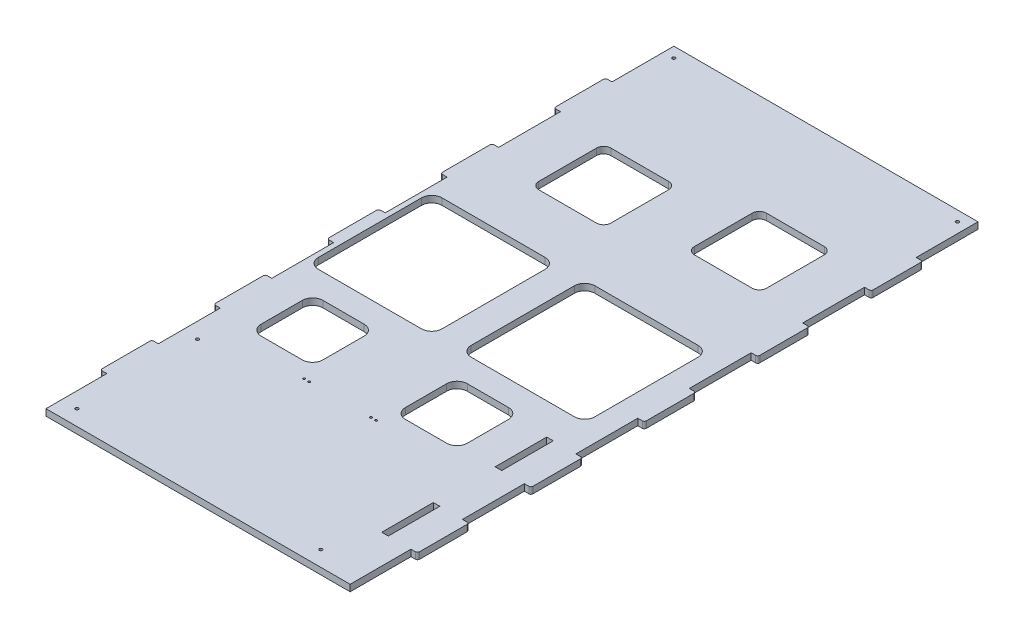
from build123d import *

# Parameters (mm, degrees)
BOSS_EXTRUDE1_DEPTH = 6.35
FILLET1_R           = 2
SKETCH2_R           = 1.5
SKETCH2_R_2         = 1.025
SKETCH2_W           = 6.35
SKETCH2_H           = 50
SKETCH2_W_2         = 120
SKETCH2_H_2         = 120
CUT_EXTRUDE1_DEPTH  = 6.35
FILLET2_R           = 10


with BuildPart() as part:
    # Sketch1 → Boss-Extrude1 (new body)
    with BuildSketch(Plane(origin=(0, 0, 0), x_dir=(1, 0, 0), z_dir=(0, 1, 0))):
        Polygon((0, 0), (295, 0), (295, 59), (301.35, 59), (301.35, 109), (295, 109), (295, 169), (301.35, 169), (301.35, 219), (295, 219), (295, 279), (301.35, 279), (301.35, 329), (295, 329), (295, 389), (301.35, 389), (301.35, 439), (295, 439), (295, 499), (301.35, 499), (301.35, 549), (295, 549), (295, 609), (0, 609), (0, 549), (-6.35, 549), (-6.35, 499), (0, 499), (0, 439), (-6.35, 439), (-6.35, 389), (0, 389), (0, 329), (-6.35, 329), (-6.35, 279), (0, 279), (0, 219), (-6.35, 219), (-6.35, 169), (0, 169), (0, 109), (-6.35, 109), (-6.35, 59), (0, 59), align=None)
    extrude(amount=BOSS_EXTRUDE1_DEPTH)

    # Fillet1
    fillet1_edges = [part.edges().sort_by_distance(p)[0] for p in [
        (301.35, 3.175, -549),
        (301.35, 3.175, -499),
        (301.35, 3.175, -439),
        (301.35, 3.175, -389),
        (301.35, 3.175, -329),
        (301.35, 3.175, -279),
        (301.35, 3.175, -219),
        (301.35, 3.175, -169),
        (301.35, 3.175, -109),
        (301.35, 3.175, -59),
        (-6.35, 3.175, -59),
        (-6.35, 3.175, -109),
        (-6.35, 3.175, -169),
        (-6.35, 3.175, -219),
        (-6.35, 3.175, -279),
        (-6.35, 3.175, -329),
        (-6.35, 3.175, -389),
        (-6.35, 3.175, -439),
        (-6.35, 3.175, -499),
        (-6.35, 3.175, -549),
    ]]
    fillet(fillet1_edges, radius=FILLET1_R)

    # Sketch2 → Cut-Extrude1 (cut)
    with BuildSketch(Plane(origin=(0, 6.35, 0), x_dir=(1, 0, 0), z_dir=(0, 1, 0))):
        with Locations((15, 15)):
            Circle(SKETCH2_R)
        with Locations((251.65, 15)):
            Circle(SKETCH2_R)
        with Locations((15, 131.925897501)):
            Circle(SKETCH2_R)
        with Locations((10, 599)):
            Circle(SKETCH2_R)
        with Locations((285, 599)):
            Circle(SKETCH2_R)
        with Locations((100, 150.297977664)):
            Circle(SKETCH2_R_2)
        with Locations((105, 150.297977664)):
            Circle(SKETCH2_R_2)
        with Locations((165, 150.297977664)):
            Circle(SKETCH2_R_2)
        with Locations((170, 150.297977664)):
            Circle(SKETCH2_R_2)
        with Locations((269.825, 194)):
            Rectangle(SKETCH2_W, SKETCH2_H)
        with Locations((269.825, 84)):
            Rectangle(SKETCH2_W, SKETCH2_H)
        with BuildLine():
            Line((55.042435698, 492.876808594), (111.042435698, 492.876808594))
            ThreePointArc((111.042435698, 492.876808594), (115.992183166, 490.826556062), (118.042435698, 485.876808594))
            Line((118.042435698, 485.876808594), (118.042435698, 429.876808594))
            ThreePointArc((118.042435698, 429.876808594), (115.992183166, 424.927061126), (111.042435698, 422.876808594))
            Line((111.042435698, 422.876808594), (55.042435698, 422.876808594))
            ThreePointArc((55.042435698, 422.876808594), (50.09268823, 424.927061126), (48.042435698, 429.876808594))
            Line((48.042435698, 429.876808594), (48.042435698, 485.876808594))
            ThreePointArc((48.042435698, 485.876808594), (50.09268823, 490.826556062), (55.042435698, 492.876808594))
        make_face()
        with BuildLine():
            Line((185.233522799, 513.658142081), (241.233522799, 513.658142081))
            ThreePointArc((241.233522799, 513.658142081), (246.183270267, 511.607889549), (248.233522799, 506.658142081))
            Line((248.233522799, 506.658142081), (248.233522799, 450.658142081))
            ThreePointArc((248.233522799, 450.658142081), (246.183270267, 445.708394612), (241.233522799, 443.658142081))
            Line((241.233522799, 443.658142081), (185.233522799, 443.658142081))
            ThreePointArc((185.233522799, 443.658142081), (180.283775331, 445.708394612), (178.233522799, 450.658142081))
            Line((178.233522799, 450.658142081), (178.233522799, 506.658142081))
            ThreePointArc((178.233522799, 506.658142081), (180.283775331, 511.607889549), (185.233522799, 513.658142081))
        make_face()
        with BuildLine():
            Line((43.325, 225.297977664), (83.325, 225.297977664))
            ThreePointArc((83.325, 225.297977664), (90.396067812, 222.369045476), (93.325, 215.297977664))
            Line((93.325, 215.297977664), (93.325, 175.297977664))
            ThreePointArc((93.325, 175.297977664), (90.396067812, 168.226909853), (83.325, 165.297977664))
            Line((83.325, 165.297977664), (43.325, 165.297977664))
            ThreePointArc((43.325, 165.297977664), (36.253932188, 168.226909853), (33.325, 175.297977664))
            Line((33.325, 175.297977664), (33.325, 215.297977664))
            ThreePointArc((33.325, 215.297977664), (36.253932188, 222.369045476), (43.325, 225.297977664))
        make_face()
        with Locations((65, 309.153604097)):
            Rectangle(SKETCH2_W_2, SKETCH2_H_2)
        with Locations((213, 309.452802196)):
            Rectangle(SKETCH2_W_2, SKETCH2_H_2)
        with BuildLine():
            Line((173.325, 215.297977664), (173.325, 175.297977664))
            ThreePointArc((173.325, 175.297977664), (176.253932188, 168.226909853), (183.325, 165.297977664))
            Line((183.325, 165.297977664), (223.325, 165.297977664))
            ThreePointArc((223.325, 165.297977664), (230.396067812, 168.226909853), (233.325, 175.297977664))
            Line((233.325, 175.297977664), (233.325, 215.297977664))
            ThreePointArc((233.325, 215.297977664), (230.396067812, 222.369045476), (223.325, 225.297977664))
            Line((223.325, 225.297977664), (183.325, 225.297977664))
            ThreePointArc((183.325, 225.297977664), (176.253932188, 222.369045476), (173.325, 215.297977664))
        make_face()
    extrude(amount=-CUT_EXTRUDE1_DEPTH, mode=Mode.SUBTRACT)

    # Fillet2
    fillet2_edges = [part.edges().sort_by_distance(p)[0] for p in [
        (125, 3.175, -249.153604097),
        (5, 3.175, -249.153604097),
        (5, 3.175, -369.153604097),
        (125, 3.175, -369.153604097),
        (153, 3.175, -249.452802196),
        (273, 3.175, -249.452802196),
        (273, 3.175, -369.452802196),
        (153, 3.175, -369.452802196),
    ]]
    fillet(fillet2_edges, radius=FILLET2_R)


solid = part.part
